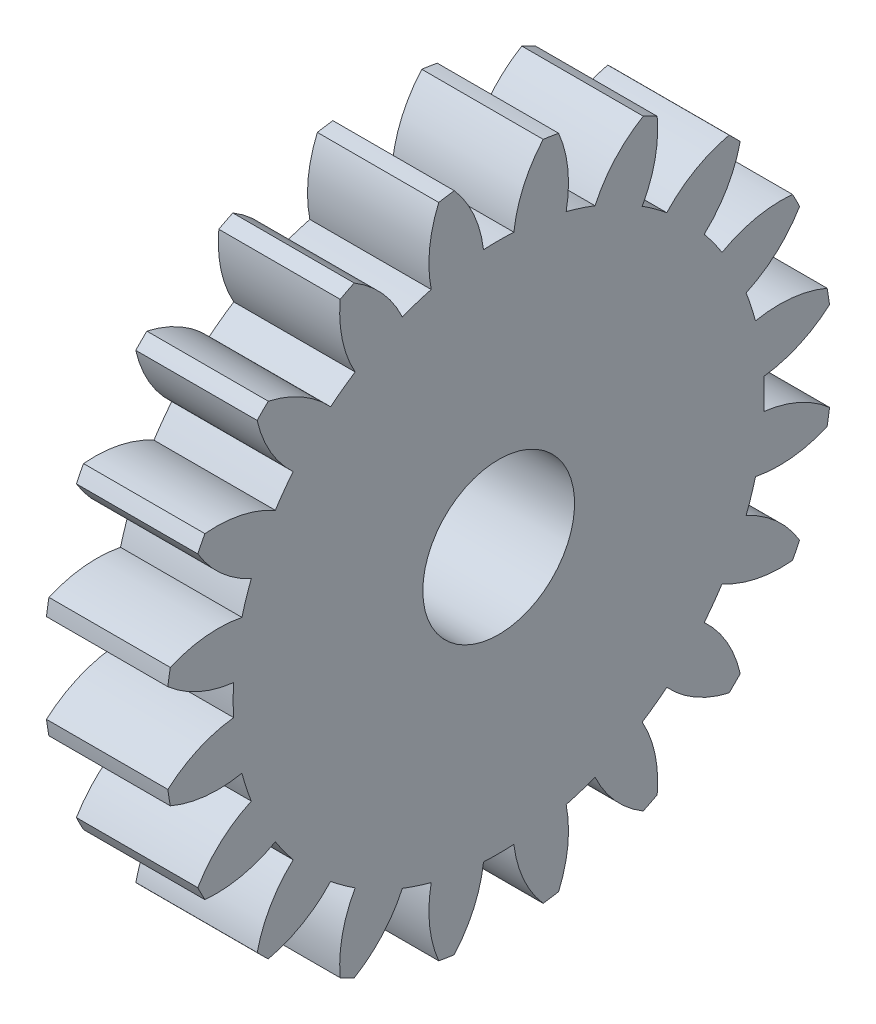
from build123d import *

# Parameters (mm, degrees)
BASPROSKE_W     = 4
BASPROSKE_H     = 11
TOOTHCUT_DEPTH  = 17.062378404
TEETHCUTS_COUNT = 20
TEETHCUTS_ANGLE = 342
BORSKE_R        = 2.5
BORE_DEPTH      = 50.0000508


with BuildPart() as part:
    # BasProSke → Base-Revolve (revolve)
    with BuildSketch(Plane(origin=(0, 0, 0), x_dir=(1, 0, 0), z_dir=(0, 1, 0))):
        with Locations((2, 5.5)):
            Rectangle(BASPROSKE_W, BASPROSKE_H)
    revolve(axis=Axis((-10, 0, 0), (1, 0, 0)))

    # TooCutSke → ToothCut (cut, through all)
    with BuildSketch(Plane(origin=(0, 0, 0), x_dir=(0, 0, -1), z_dir=(1, 0, 0))):
        with BuildLine():
            ThreePointArc((0.499924007, 8.734705318), (0, 8.749), (-0.499924007, 8.734705318))
            ThreePointArc((-0.499924007, 8.734705318), (-0.824302243, 9.905497836), (-1.485192705, 10.924909509))
            ThreePointArc((-1.485192705, 10.924909509), (0, 11.0254), (1.485192705, 10.924909509))
            ThreePointArc((1.485192705, 10.924909509), (0.824302243, 9.905497836), (0.499924007, 8.734705318))
        make_face()
    toothcut = extrude(amount=TOOTHCUT_DEPTH, mode=Mode.SUBTRACT)

    # TeethCuts: ToothCut ×20 about axis
    teethcuts_axis = Axis((-10, 0, 0), (1, 0, 0))
    for i in range(1, TEETHCUTS_COUNT):
        add(toothcut.rotate(teethcuts_axis, i * TEETHCUTS_ANGLE / (TEETHCUTS_COUNT - 1)), mode=Mode.SUBTRACT)

    # BorSke → Bore (cut, symmetric)
    with BuildSketch(Plane(origin=(0, 0, 0), x_dir=(0, 0, -1), z_dir=(1, 0, 0))):
        Circle(BORSKE_R)
    extrude(amount=BORE_DEPTH, both=True, mode=Mode.SUBTRACT)


solid = part.part
